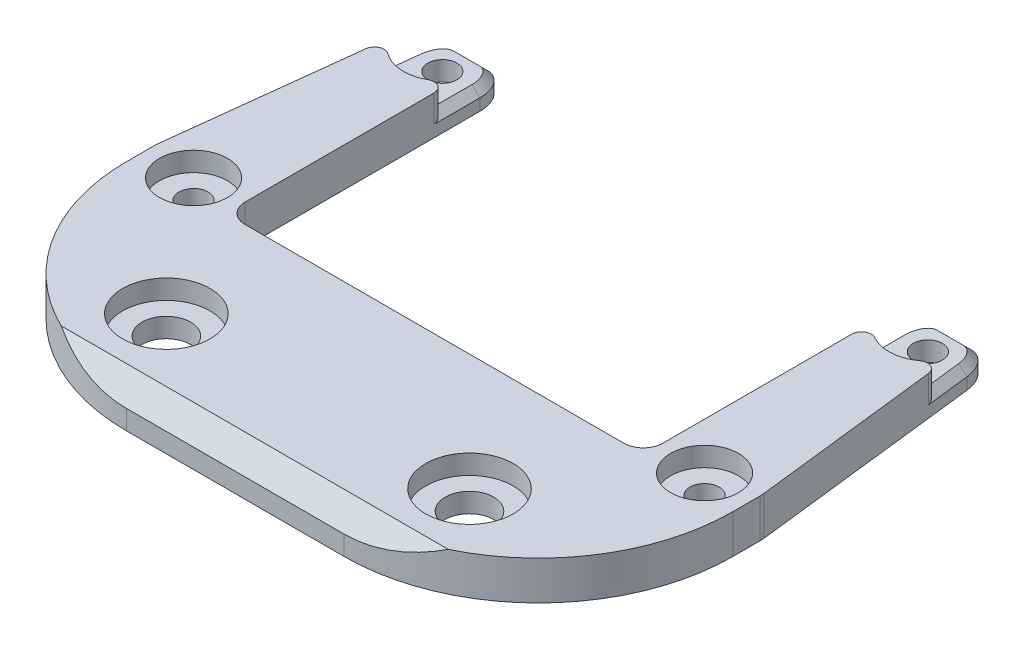
from build123d import *

# Parameters (mm, degrees)
SZKIC1_R                    = 1.5
SZKIC1_R_2                  = 2.5
DODANIE_WYCI_GNI_CIE1_DEPTH = 4
ZAOKR_GLENIE1_R             = 20
SZKIC2_R                    = 3.5
SZKIC2_R_2                  = 4
SZKIC2_R_3                  = 4.5
WYTNIJ_WYCI_GNI_CIE1_DEPTH  = 2
ZAOKR_GLENIE2_R             = 1
SFAZOWANIE2_SIZE            = 0.8


with BuildPart() as part:
    # Szkic1 → Dodanie-wyciągnięcie1 (new body)
    with BuildSketch(Plane(origin=(0, 0, 0), x_dir=(1, 0, 0), z_dir=(0, 1, 0))):
        with BuildLine():
            Line((1.659006671, 58.277593275), (-1.119868317, 58.277593275))
            add(Edge.make_bspline(
                [(-1.119868317, 58.277593275), (-2.968900305, 58.277593275), (-3.270926516, 55.680167866)],
                knots=[3.223355162, 3.223355162, 3.223355162, 4.71238898, 4.71238898, 4.71238898], degree=2, weights=[1, 0.735415338, 1]))
            Line((-3.270926516, 55.680167866), (-6.019830139, 32.039596707))
            ThreePointArc((-6.019830139, 32.039596707), (-6.039902389, 31.808982465), (-6.046600617, 31.577593275))
            Line((-6.046600617, 31.577593275), (-6.046600617, 8.777593275))
            Line((-6.046600617, 8.777593275), (56.36461396, 8.777593275))
            Line((56.36461396, 8.777593275), (56.36461396, 31.577593275))
            ThreePointArc((56.36461396, 31.577593275), (56.357915732, 31.808982465), (56.337843482, 32.039596707))
            Line((56.337843482, 32.039596707), (53.588939858, 55.680167866))
            add(Edge.make_bspline(
                [(53.588939858, 55.680167866), (53.286913648, 58.277593275), (51.43788166, 58.277593275)],
                knots=[1.570796327, 1.570796327, 1.570796327, 3.059830145, 3.059830145, 3.059830145], degree=2, weights=[1, 0.735415338, 1]))
            Line((51.43788166, 58.277593275), (48.659006671, 58.277593275))
            add(Edge.make_bspline(
                [(48.659006671, 58.277593275), (46.659006671, 58.277593275), (46.659006671, 55.44916615)],
                knots=[3.141592654, 3.141592654, 3.141592654, 4.71238898, 4.71238898, 4.71238898], degree=2, weights=[1, 0.707106781, 1]))
            Line((46.659006671, 55.44916615), (46.659006671, 31.277593275))
            ThreePointArc((46.659006671, 31.277593275), (46.073220234, 29.863379712), (44.659006671, 29.277593275))
            Line((44.659006671, 29.277593275), (5.659006671, 29.277593275))
            ThreePointArc((5.659006671, 29.277593275), (4.244793109, 29.863379712), (3.659006671, 31.277593275))
            Line((3.659006671, 31.277593275), (3.659006671, 55.44916615))
            add(Edge.make_bspline(
                [(3.659006671, 55.44916615), (3.659006671, 58.277593275), (1.659006671, 58.277593275)],
                knots=[1.570796327, 1.570796327, 1.570796327, 3.141592654, 3.141592654, 3.141592654], degree=2, weights=[1, 0.707106781, 1]))
        make_face()
        with Locations(Location((50.145621432, 55.076817676, 0), (0, 0, 270))):
            Circle(SZKIC1_R, mode=Mode.SUBTRACT)
        with Locations(Location((0.172391911, 55.076817676, 0), (0, 0, 270))):
            Circle(SZKIC1_R, mode=Mode.SUBTRACT)
        with Locations(Location((-1.144922446, 30.775394297, 0), (0, 0, 270))):
            Circle(SZKIC1_R, mode=Mode.SUBTRACT)
        with Locations(Location((51.462935789, 30.775394297, 0), (0, 0, 270))):
            Circle(SZKIC1_R, mode=Mode.SUBTRACT)
        with Locations(Location((40.761810316, 17.277593275, 0), (0, 0, 270))):
            Circle(SZKIC1_R_2, mode=Mode.SUBTRACT)
        with Locations(Location((9.556203027, 17.277593275, 0), (0, 0, 90))):
            Circle(SZKIC1_R_2, mode=Mode.SUBTRACT)
    extrude(amount=DODANIE_WYCI_GNI_CIE1_DEPTH)

    # Zaokrąglenie1
    zaokr_glenie1_edges = [part.edges().sort_by_distance(p)[0] for p in [
        (56.36461396, 2, -8.777593275),
        (-6.046600617, 2, -8.777593275),
    ]]
    fillet(zaokr_glenie1_edges, radius=ZAOKR_GLENIE1_R)

    # Szkic2 → Wytnij-wyciągnięcie1 (cut)
    with BuildSketch(Plane(origin=(0, 4, 0), x_dir=(1, 0, 0), z_dir=(0, 1, 0))):
        with Locations(Location((51.462935789, 30.775394297, 0), (0, 0, 270))):
            Circle(SZKIC2_R)
        with Locations((50.145621432, 55.076817676)):
            Circle(SZKIC2_R_2)
        with Locations((0.172391911, 55.076817676)):
            Circle(SZKIC2_R_2)
        with Locations(Location((-1.144922446, 30.775394297, 0), (0, 0, 270))):
            Circle(SZKIC2_R)
        with Locations(Location((9.556203027, 17.277593275, 0), (0, 0, 270))):
            Circle(SZKIC2_R_3)
        with Locations(Location((40.761810316, 17.277593275, 0), (0, 0, 270))):
            Circle(SZKIC2_R_3)
    extrude(amount=-WYTNIJ_WYCI_GNI_CIE1_DEPTH, mode=Mode.SUBTRACT)

    # Zaokrąglenie2
    zaokr_glenie2_edges = [part.edges().sort_by_distance(p)[0] for p in [
        (53.837974946, 3, -53.538466114),
        (-3.519961603, 3, -53.538466114),
        (3.659006671, 3, -53.116328576),
        (46.659006671, 3, -53.116328576),
    ]]
    fillet(zaokr_glenie2_edges, radius=ZAOKR_GLENIE2_R)

    # Sfazowanie1
    # the kernel refuses this chamfer: 2 mm, written as the material it takes off along each edge
    with BuildSketch(Plane(origin=(1.60932104, 4, -8.777593275), x_dir=(0, 0.027495876610586487, -0.9996219169112968), z_dir=(1, 0, 0))) as sfazowanie1_piece_1:
        with BuildLine():
            Line((2.05734639, 0), (-0.11309431, -2.054235587))
            Line((-0.11309431, -2.054235587), (-0.153079186, -2.053135752))
            ThreePointArc((-0.153079186, -2.053135752), (-0.068258454, -1.026795659), (-0.039984877, 0.001099835))
            Line((-0.039984877, 0.001099835), (0.001099835, 0.039984877))
            ThreePointArc((0.001099835, 0.039984877), (1.028995329, 0.011711299), (2.058446225, 0.039984877))
            Line((2.058446225, 0.039984877), (2.05734639, 0))
        make_face()
    extrude(amount=47.099371262, mode=Mode.SUBTRACT)

    # Sfazowanie2
    sfazowanie2_edges = [part.edges().sort_by_distance(p)[0] for p in [
        (3.659006671, 2, -53.094078185),
        (-3.532969865, 2, -53.426595059),
        (3.185598698, 2, -57.276468397),
        (-2.638843717, 2, -57.379483489),
        (0.269569177, 2, -58.277593275),
        (53.850983208, 2, -53.426595059),
        (46.659006671, 2, -53.094078185),
        (52.95685706, 2, -57.37948349),
        (47.132414645, 2, -57.276468396),
        (50.048444166, 2, -58.277593275),
    ]]
    chamfer(sfazowanie2_edges, length=SFAZOWANIE2_SIZE)


solid = part.part
